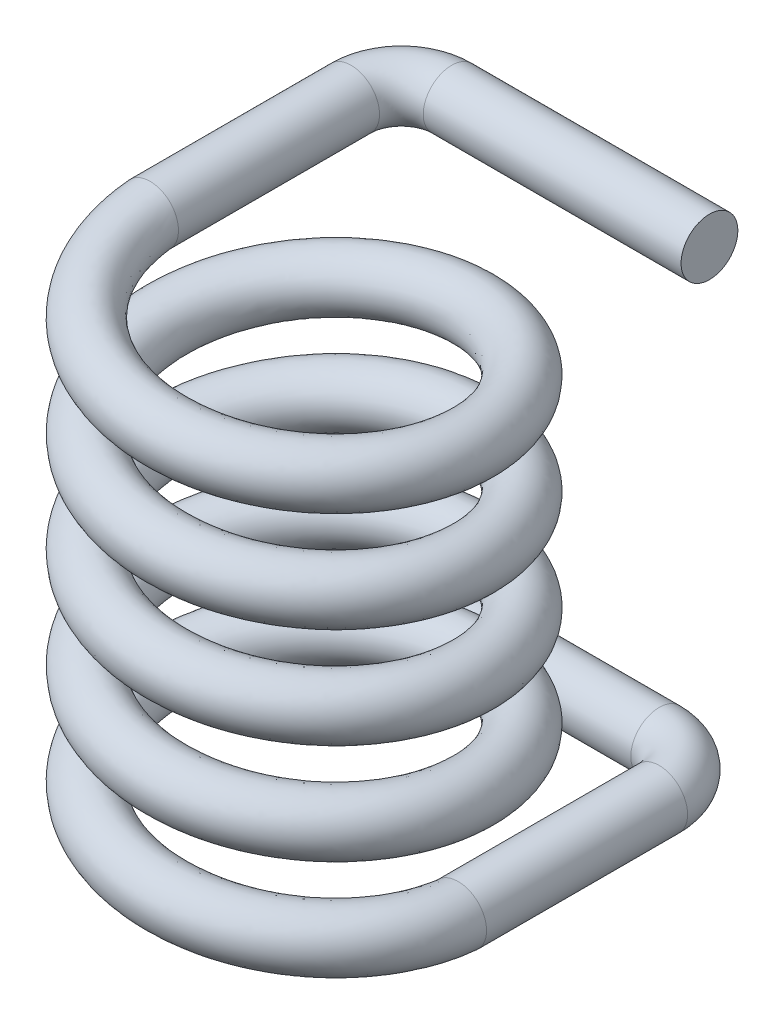
from build123d import *

# Parameters (mm, degrees)
SWEEP1_PITCH       = 4
SWEEP1_HEIGHT      = 18
SWEEP1_RADIUS      = 6.13
SWEEP1_START_ANGLE = 90
SKETCH1_R          = 1.13
SKETCH1_3_R        = 1.13
SWEEP3_OUTLINE_R   = 1.13
SWEEP3_ANGLE       = 90
SWEEP3_START       = -8.0000001
SWEEP3_2_OUTLINE_R = 1.13
SWEEP3_2_DEPTH     = 8.0000001
SWEEP3_START_2     = -4.1300001
SWEEP3_3_OUTLINE_R = 1.13
SWEEP3_3_DEPTH     = 10.2600001


with BuildPart() as part:
    # Sweep1: sweep along a helix
    with BuildLine() as sweep1_path:
        add(Helix(SWEEP1_PITCH, SWEEP1_HEIGHT, SWEEP1_RADIUS, center=(0, 0, 0), direction=(0, 1, 0), lefthand=True, mode=Mode.PRIVATE).rotate(Axis((0, 0, 0), (0, 1, 0)), SWEEP1_START_ANGLE))
    # Sketch1 → Sweep1 (sweep)
    with BuildSketch(Plane.XY):
        with Locations((6.13, 0)):
            Circle(SKETCH1_R)
    sweep(path=sweep1_path.line, is_frenet=True)

    # Sweep2: sweep along a path in Sketch3
    with BuildLine(Plane(origin=(0, 0, 0), x_dir=(1, 0, 0), z_dir=(0, 1, 0))) as sweep2_path:
        Line((6.13, 0), (6.13, 8))
        ThreePointArc((6.13, 8), (5.544213562, 9.414213562), (4.13, 10))
        Line((4.13, 10), (-6.13, 10))
    # Sketch1<3> → Sweep2 (sweep)
    with BuildSketch(Plane.XY):
        with Locations((6.13, 0)):
            Circle(SKETCH1_3_R)
    sweep(path=sweep2_path.line)



with BuildPart() as body_2:
    # Sweep3: read off the stored shape, not the designer's step
    # Sweep3 outline → Sweep3 (revolve)
    with BuildSketch(Plane(origin=(-4.13, 0, -8), x_dir=(0, 0, -1), z_dir=(1, 0, 0))):
        with Locations((2, 18)):
            Circle(SWEEP3_OUTLINE_R)
    revolve(axis=Axis((-4.13, 0, -8), (0, 1, 0)), revolution_arc=SWEEP3_ANGLE)


with BuildPart() as part_1:
    add(part.part)

    add(body_2.part)  # Sweep3 2 merges body 2
    # Sweep3 2 outline → Sweep3 2 (add)
    with BuildSketch(Plane.XY.offset(SWEEP3_START)):
        with Locations((-6.13, 18)):
            Circle(SWEEP3_2_OUTLINE_R)
    extrude(amount=SWEEP3_2_DEPTH)

    # Sweep3 3 outline → Sweep3 3 (add)
    with BuildSketch(Plane.YZ.offset(SWEEP3_START_2)):
        with Locations((18, -10)):
            Circle(SWEEP3_3_OUTLINE_R)
    extrude(amount=SWEEP3_3_DEPTH)


solid = part_1.part
